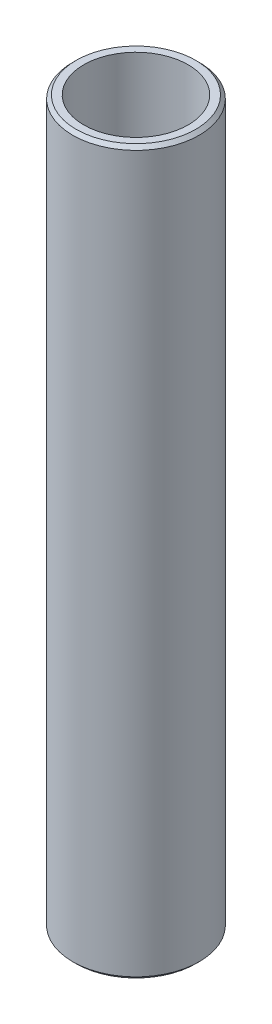
from build123d import *

# Parameters (mm, degrees)
SKETCH1_R           = 52.5
BOSS_EXTRUDE1_DEPTH = 600
SKETCH2_R           = 43.338423678
CUT_EXTRUDE1_DEPTH  = 605.576297914
CHAMFER1_SIZE       = 2.835487283


with BuildPart() as part:
    # Sketch1 → Boss-Extrude1 (new body)
    with BuildSketch(Plane(origin=(0, 0, 0), x_dir=(1, 0, 0), z_dir=(0, 1, 0))):
        Circle(SKETCH1_R)
    extrude(amount=BOSS_EXTRUDE1_DEPTH)

    # Sketch2 → Cut-Extrude1 (cut, through all)
    with BuildSketch(Plane(origin=(0, 0, 0), x_dir=(1, 0, 0), z_dir=(0, 1, 0))):
        Circle(SKETCH2_R)
    extrude(amount=CUT_EXTRUDE1_DEPTH, mode=Mode.SUBTRACT)

    # Chamfer1
    chamfer1_edges = [part.edges().sort_by_distance(p)[0] for p in [
        (-52.5, 600, 0),
        (-52.5, 0, 0),
    ]]
    chamfer(chamfer1_edges, length=CHAMFER1_SIZE)


solid = part.part
